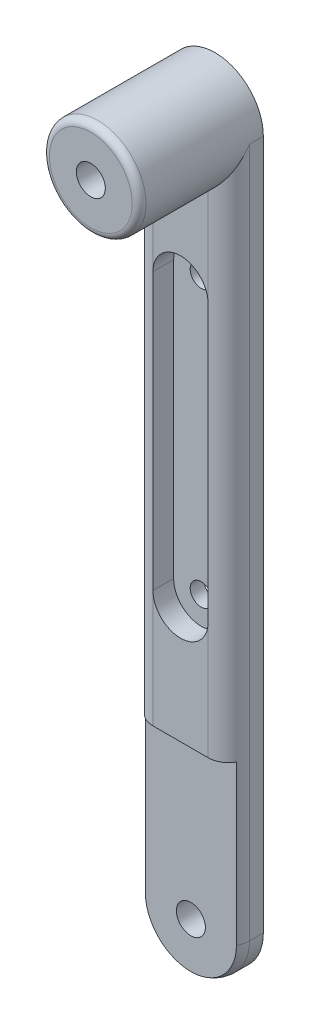
from build123d import *

# Parameters (mm, degrees)
SKETCH1_R           = 7
BOSS_EXTRUDE1_DEPTH = 18
SKETCH2_W           = 14
SKETCH2_H           = 100
BOSS_EXTRUDE2_DEPTH = 5
SKETCH8_R           = 2.1
CUT_EXTRUDE5_DEPTH  = 18
SKETCH9_R           = 7
BOSS_EXTRUDE4_DEPTH = 5
FILLET3_R           = 3
CUT_EXTRUDE6_DEPTH  = 3
SKETCH10_R          = 1.6
CUT_EXTRUDE7_DEPTH  = 3
SKETCH11_W          = 14
SKETCH11_H          = 30
CUT_EXTRUDE8_DEPTH  = 1.5
SKETCH12_R          = 2.1
CUT_EXTRUDE9_DEPTH  = 4
FILLET4_R           = 1


with BuildPart() as part:
    # Sketch1 → Boss-Extrude1 (new body)
    with BuildSketch(Plane.XY):
        Circle(SKETCH1_R)
    extrude(amount=BOSS_EXTRUDE1_DEPTH)

    # Sketch2 → Boss-Extrude2 (add)
    with BuildSketch(Plane.XY):
        with Locations((0, -50)):
            Rectangle(SKETCH2_W, SKETCH2_H)
    extrude(amount=BOSS_EXTRUDE2_DEPTH)

    # Sketch8 → Cut-Extrude5 (cut)
    with BuildSketch(Plane.XY.offset(18)):
        Circle(SKETCH8_R)
    extrude(amount=-CUT_EXTRUDE5_DEPTH, mode=Mode.SUBTRACT)

    # Sketch9 → Boss-Extrude4 (add)
    with BuildSketch(Plane.XY.offset(5)):
        with Locations((0, -100)):
            Circle(SKETCH9_R)
    extrude(amount=-BOSS_EXTRUDE4_DEPTH)

    # Fillet3
    # the kernel refuses this fillet: 3 mm, written as the material it takes off along each edge
    with BuildSketch(Plane(origin=(7, 7.5, 5), x_dir=(-1, 0, 0), z_dir=(0, -1, 0))) as fillet3_piece_1_section:
        with BuildLine():
            CenterArc((FILLET3_R, FILLET3_R), FILLET3_R, 180, 90)
            Line((0, FILLET3_R), (0, 0))
            Line((0, 0), (FILLET3_R, 0))
        make_face()
    fillet3_piece_1 = extrude(amount=107.5, mode=Mode.PRIVATE)
    fillet3_piece_1 = fillet3_piece_1 - Plane(origin=(0, 0, 4.308954976), x_dir=(1, 0, 0), z_dir=(0, 0, -1)) * Cylinder(7, 227, mode=Mode.PRIVATE)
    add(fillet3_piece_1, mode=Mode.SUBTRACT)
    with BuildSketch(Plane(origin=(0, -100, 5), x_dir=(-1, 0, 0), z_dir=(0, 1, 0))) as fillet3_piece_2:
        with BuildLine():
            CenterArc((7 - FILLET3_R, -FILLET3_R), FILLET3_R, 0, 90)
            Line((7, -FILLET3_R), (7, 0))
            Line((7, 0), (7 - FILLET3_R, 0))
        make_face()
    revolve(axis=Axis((0, -100, 5), (0, 0, 1)), revolution_arc=180, mode=Mode.SUBTRACT)
    with BuildSketch(Plane(origin=(-7, -100, 5), x_dir=(0, 0, -1), z_dir=(0, 1, 0))) as fillet3_piece_3_section:
        with BuildLine():
            CenterArc((FILLET3_R, -FILLET3_R), FILLET3_R, 90, 90)
            Line((0, -FILLET3_R), (0, 0))
            Line((0, 0), (FILLET3_R, 0))
        make_face()
    fillet3_piece_3 = extrude(amount=107.5, mode=Mode.PRIVATE)
    fillet3_piece_3 = fillet3_piece_3 - Plane(origin=(0, 0, 4.308954508), x_dir=(1, 0, 0), z_dir=(0, 0, -1)) * Cylinder(7, 227, mode=Mode.PRIVATE)
    add(fillet3_piece_3, mode=Mode.SUBTRACT)

    # Sketch6 → Cut-Extrude6 (cut)
    with BuildSketch(Plane.XY.offset(5)):
        with BuildLine():
            Line((4, -20), (4, -60))
            ThreePointArc((4, -60), (0, -64), (-4, -60))
            Line((-4, -60), (-4, -20))
            ThreePointArc((-4, -20), (0, -16), (4, -20))
        make_face()
    extrude(amount=-CUT_EXTRUDE6_DEPTH, mode=Mode.SUBTRACT)

    # Sketch10 → Cut-Extrude7 (cut)
    with BuildSketch(Plane.XY.offset(2)):
        with Locations((0, -20)):
            Circle(SKETCH10_R)
        with Locations((0, -60)):
            Circle(SKETCH10_R)
    extrude(amount=-CUT_EXTRUDE7_DEPTH, mode=Mode.SUBTRACT)

    # Sketch11 → Cut-Extrude8 (cut)
    with BuildSketch(Plane.XY.offset(5)):
        with Locations((0, -92)):
            Rectangle(SKETCH11_W, SKETCH11_H)
    extrude(amount=-CUT_EXTRUDE8_DEPTH, mode=Mode.SUBTRACT)

    # Sketch12 → Cut-Extrude9 (cut)
    with BuildSketch(Plane.XY.offset(3.5)):
        with Locations((0, -100)):
            Circle(SKETCH12_R)
    extrude(amount=-CUT_EXTRUDE9_DEPTH, mode=Mode.SUBTRACT)

    # Fillet4
    fillet4_edges = [part.edges().sort_by_distance(p)[0] for p in [
        (-7, 0, 18),
    ]]
    fillet(fillet4_edges, radius=FILLET4_R)


solid = part.part
